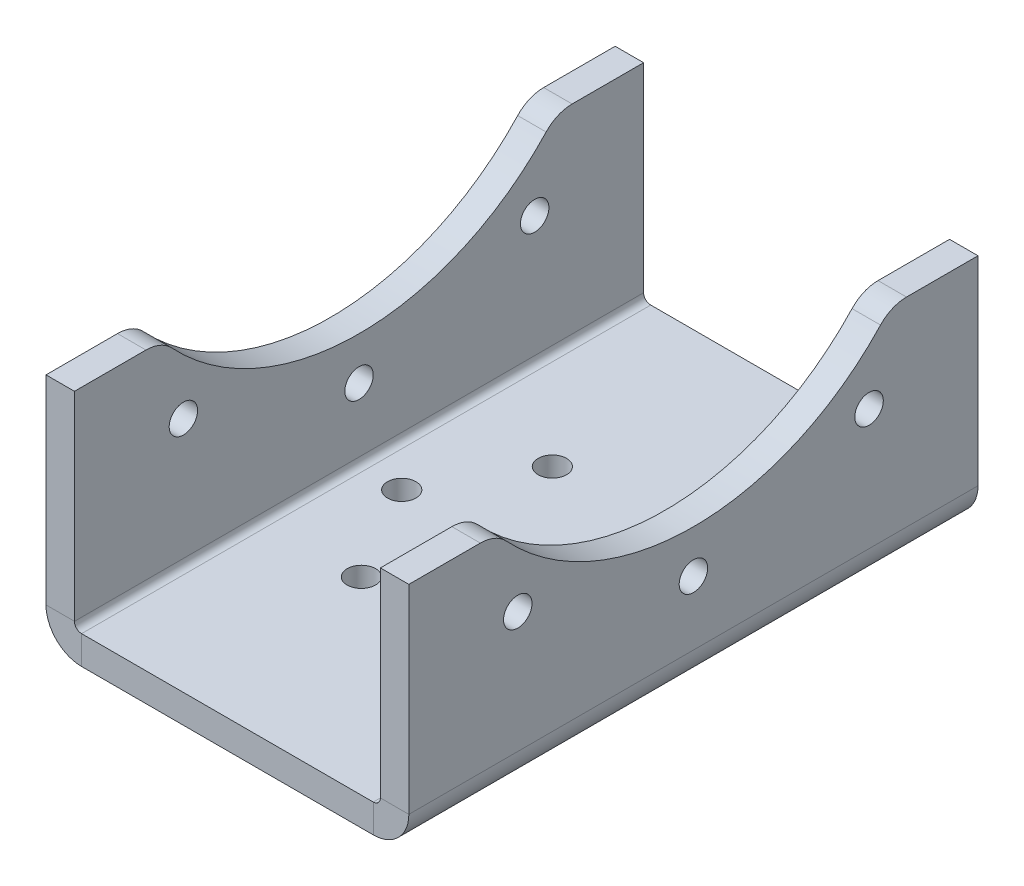
from build123d import *

# Parameters (mm, degrees)
SM_BASE_FLANGE_1_DEPTH   = 80
CUT_EXTRUDE_3_DEPTH      = 100.206854602
CUT_EXTRUDE_3_DEPTH_BACK = 100.206854602
SKETCH_6_R               = 36
SKETCH_6_R_2             = 2
FILLET_1_R               = 5
SKETCH_9_R               = 2
CUT_EXTRUDE_4_DEPTH      = 91.217792037


# Sheet-metal steps are written as plain solids
with BuildPart() as part:
    # Sketch 1 → Базовая кромка1 (new body)
    with BuildSketch(Plane.XY):
        with BuildLine():
            Line((-21.5, 29), (-21.5, 1))
            ThreePointArc((-21.5, 1), (-21.207106781, 0.292893219), (-20.5, 0))
            Line((-20.5, 0), (20.5, 0))
            ThreePointArc((20.5, 0), (21.207106781, 0.292893219), (21.5, 1))
            Line((21.5, 1), (21.5, 29))
            Line((21.5, 29), (25.5, 29))
            Line((25.5, 29), (25.5, 1))
            ThreePointArc((25.5, 1), (24.035533906, -2.535533906), (20.5, -4))
            Line((20.5, -4), (-20.5, -4))
            ThreePointArc((-20.5, -4), (-24.035533906, -2.535533906), (-25.5, 1))
            Line((-25.5, 1), (-25.5, 29))
            Line((-25.5, 29), (-21.5, 29))
        make_face()
    extrude(amount=SM_BASE_FLANGE_1_DEPTH)

    # Эскиз6 → Вырез-Вытянуть3 (cut, two sides: drawn at the far end of the back side and taken through both)
    with BuildSketch(Plane.ZY.offset(25.5).offset(-CUT_EXTRUDE_3_DEPTH_BACK)):
        with Locations((40, 52)):
            Circle(SKETCH_6_R)
        with Locations((40, 10)):
            Circle(SKETCH_6_R_2)
        with Locations((15.313019404, 18.021286236)):
            Circle(SKETCH_6_R_2)
        with Locations((64.686980596, 18.021286236)):
            Circle(SKETCH_6_R_2)
    extrude(amount=CUT_EXTRUDE_3_DEPTH + CUT_EXTRUDE_3_DEPTH_BACK, mode=Mode.SUBTRACT)

    # Скругление1
    fillet_1_edges = [part.edges().sort_by_distance(p)[0] for p in [
        (23.5, 29, 12.305235152),
        (23.5, 29, 67.694764848),
        (-23.5, 29, 12.305235152),
        (-23.5, 29, 67.694764848),
    ]]
    fillet(fillet_1_edges, radius=FILLET_1_R)

    # Эскиз9 → Вырез-Вытянуть4 (cut, through all)
    with BuildSketch(Plane.XZ.offset(4)):
        with Locations((15.5, 40)):
            Circle(SKETCH_9_R)
        with Locations((7.75, 26.576606241)):
            Circle(SKETCH_9_R)
        with Locations((-7.75, 26.576606241)):
            Circle(SKETCH_9_R)
        with Locations((-15.5, 40)):
            Circle(SKETCH_9_R)
        with Locations((-7.75, 53.423393759)):
            Circle(SKETCH_9_R)
        with Locations((7.75, 53.423393759)):
            Circle(SKETCH_9_R)
    extrude(amount=-CUT_EXTRUDE_4_DEPTH, mode=Mode.SUBTRACT)


solid = part.part
